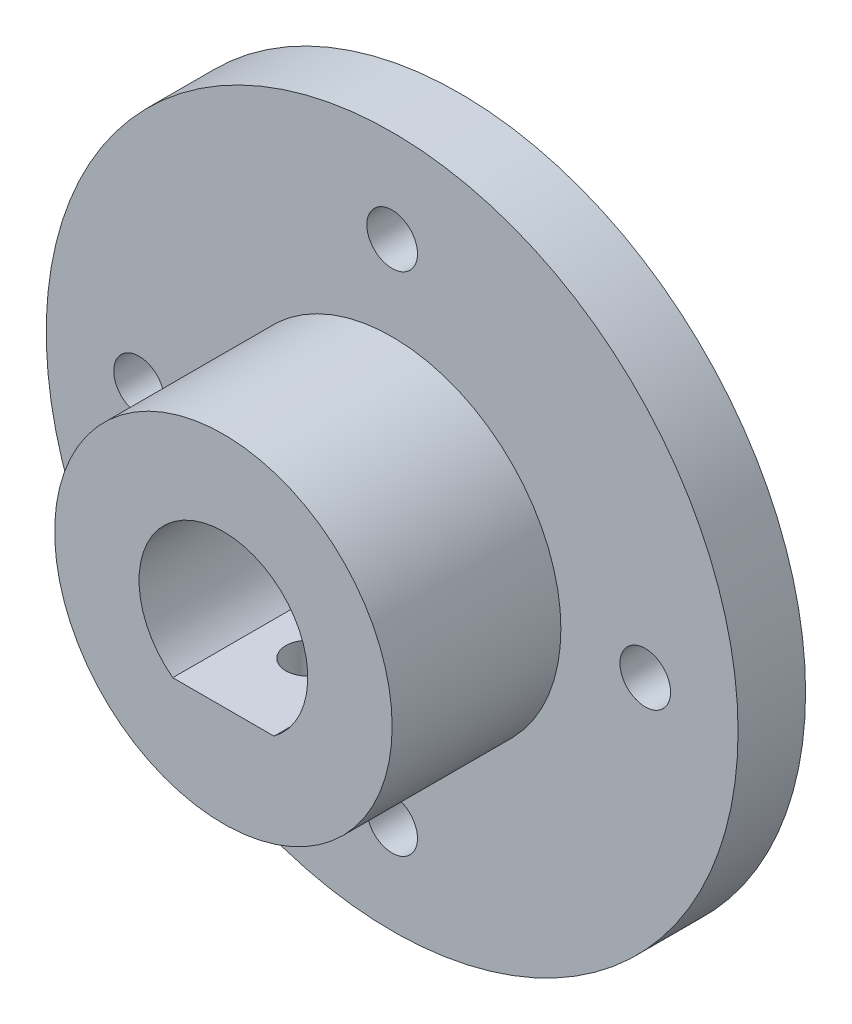
from build123d import *

# Parameters (mm, degrees)
EXTRUDE_1_DEPTH     = 4
SKETCH_2_R          = 10
EXTRUDE_2_DEPTH     = 10
SKETCH_3_R          = 1.3
CUT_EXTRUDE_1_DEPTH = 13


with BuildPart() as part:
    # 草图1 → 凸台-拉伸1 (new body)
    with BuildSketch(Plane.XY):
        with BuildLine():
            ThreePointArc((-20.5, 0), (0, -20.5), (20.5, 0))
            ThreePointArc((20.5, 0), (0, 20.5), (-20.5, 0))
        make_face()
        with BuildLine():
            Line((-3, -4), (3, -4))
            ThreePointArc((3, -4), (4.472135955, -2.236067977), (5, 0))
            ThreePointArc((5, 0), (0, 5), (-5, 0))
            ThreePointArc((-5, 0), (-4.472135955, -2.236067977), (-3, -4))
        make_face(mode=Mode.SUBTRACT)
        with BuildLine():
            ThreePointArc((-16.5, 0), (-15, -1.5), (-13.5, 0))
            ThreePointArc((-13.5, 0), (-15, 1.5), (-16.5, 0))
        make_face(mode=Mode.SUBTRACT)
        with BuildLine():
            ThreePointArc((-1.5, -15), (0, -16.5), (1.5, -15))
            ThreePointArc((1.5, -15), (0, -13.5), (-1.5, -15))
        make_face(mode=Mode.SUBTRACT)
        with BuildLine():
            ThreePointArc((13.5, 0), (15, -1.5), (16.5, 0))
            ThreePointArc((16.5, 0), (15, 1.5), (13.5, 0))
        make_face(mode=Mode.SUBTRACT)
        with BuildLine():
            ThreePointArc((-1.5, 15), (0, 13.5), (1.5, 15))
            ThreePointArc((1.5, 15), (0, 16.5), (-1.5, 15))
        make_face(mode=Mode.SUBTRACT)
    extrude(amount=EXTRUDE_1_DEPTH)

    # 草图2 → 凸台-拉伸2 (add)
    with BuildSketch(Plane.XY.offset(4)):
        Circle(SKETCH_2_R)
        with BuildLine():
            Line((-3, -4), (3, -4))
            ThreePointArc((3, -4), (0, 5), (-3, -4))
        make_face(mode=Mode.SUBTRACT)
    extrude(amount=EXTRUDE_2_DEPTH)

    # 草图3 → 切除-拉伸1 (cut)
    with BuildSketch(Plane(origin=(0, 0, 0), x_dir=(1, 0, 0), z_dir=(0, 1, 0))):
        with Locations((0, -9)):
            Circle(SKETCH_3_R)
    extrude(amount=-CUT_EXTRUDE_1_DEPTH, mode=Mode.SUBTRACT)


solid = part.part
